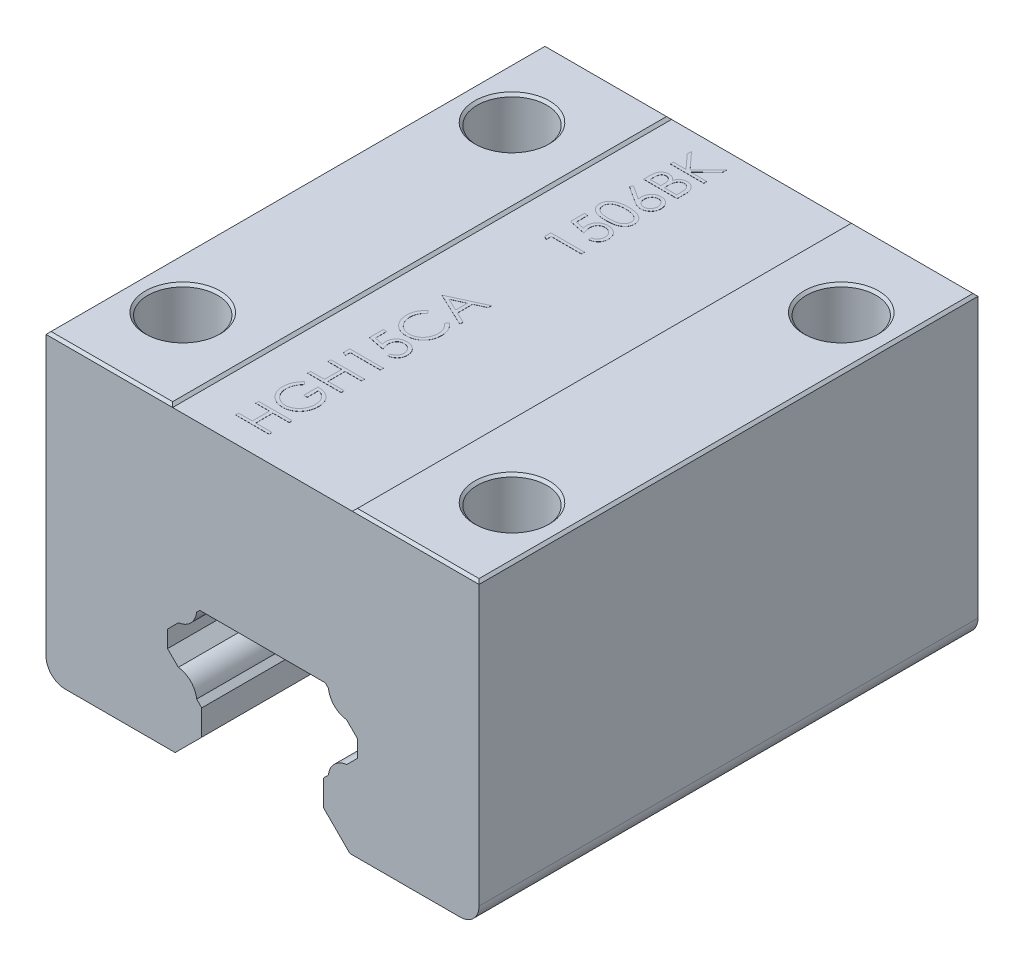
from build123d import *

# Parameters (mm, degrees)
EXTRUDE_1_DEPTH     = 39.4
SKETCH_3_R          = 2.75
CUT_EXTRUDE_2_DEPTH = 5
CHAMFER_1_SIZE      = 0.2
EXTRUDE_2_DEPTH     = 0.01


with BuildPart() as part:
    # Model → Бобышка-Вытянуть1 (new body)
    with BuildSketch(Plane.XY):
        with BuildLine():
            Line((-17.0982035, 1.500004059), (-17.0982035, 23.700000457))
            Line((-17.0982035, 23.700000457), (-7.0982035, 23.700000457))
            Line((-7.0982035, 23.700000457), (-7.0982035, 23.500000457))
            Line((-7.0982035, 23.500000457), (7.098195917, 23.500000457))
            Line((7.098195917, 23.500000457), (7.098195917, 23.700000457))
            Line((7.098195917, 23.700000457), (17.098195917, 23.700000457))
            Line((17.098195917, 23.700000457), (17.098195917, 1.499999547))
            ThreePointArc((17.098195917, 1.499999547), (16.6588565, 0.439340163), (15.598197237, 4.57e-07))
            Line((15.598197237, 4.57e-07), (6.899437737, 4.57e-07))
            Line((6.899437737, 4.57e-07), (4.799803337, 2.099634857))
            Line((4.799803337, 2.099634857), (4.799803337, 4.109149719))
            Line((4.799803337, 4.109149719), (5.200757016, 4.510103609))
            ThreePointArc((5.200757016, 4.510103609), (5.668920845, 5.489261965), (6.648079248, 5.957425695))
            Line((6.648079248, 5.957425695), (7.499998637, 6.809345503))
            Line((7.499998637, 6.809345503), (7.499998637, 8.149454901))
            Line((7.499998637, 8.149454901), (6.634489549, 9.014965643))
            ThreePointArc((6.634489549, 9.014965643), (5.66892081, 9.481617583), (5.20226883, 10.447186303))
            Line((5.20226883, 10.447186303), (4.949454863, 10.700000457))
            Line((4.949454863, 10.700000457), (-4.94945759, 10.700000457))
            Line((-4.94945759, 10.700000457), (-5.202271557, 10.447186303))
            ThreePointArc((-5.202271557, 10.447186303), (-5.668923537, 9.481617583), (-6.634492276, 9.014965643))
            Line((-6.634492276, 9.014965643), (-7.500001363, 8.149454901))
            Line((-7.500001363, 8.149454901), (-7.500001363, 6.809345503))
            Line((-7.500001363, 6.809345503), (-6.648081975, 5.957425695))
            ThreePointArc((-6.648081975, 5.957425695), (-5.668923571, 5.489261965), (-5.200759743, 4.510103609))
            Line((-5.200759743, 4.510103609), (-4.799806063, 4.109149719))
            Line((-4.799806063, 4.109149719), (-4.799806063, 2.099634857))
            Line((-4.799806063, 2.099634857), (-6.899440463, 4.57e-07))
            Line((-6.899440463, 4.57e-07), (-15.598204006, 4.516e-06))
            ThreePointArc((-15.598204006, 4.516e-06), (-16.658863823, 0.439344227), (-17.0982035, 1.500004059))
        make_face()
    extrude(amount=EXTRUDE_1_DEPTH)

    # Эскиз3 → Вырез-Вытянуть2 (cut)
    with BuildSketch(Plane.XZ.offset(-23.700000457)):
        with Locations((-13, 32.7)):
            Circle(SKETCH_3_R)
        with Locations((-13, 6.7)):
            Circle(SKETCH_3_R)
        with Locations((13, 6.7)):
            Circle(SKETCH_3_R)
        with Locations((13, 32.7)):
            Circle(SKETCH_3_R)
    extrude(amount=CUT_EXTRUDE_2_DEPTH, mode=Mode.SUBTRACT)

    # Фаска1
    chamfer_1_edges = [part.edges().sort_by_distance(p)[0] for p in [
        (-12.0982035, 23.700000457, 0),
        (-7.0982035, 23.700000457, 19.7),
        (-12.0982035, 23.700000457, 39.4),
        (-17.0982035, 23.700000457, 19.7),
        (12.098195917, 23.700000457, 0),
        (7.098195917, 23.700000457, 19.7),
        (12.098195917, 23.700000457, 39.4),
        (17.098195917, 23.700000457, 19.7),
        (-15.75, 23.700000457, 6.7),
        (10.25, 23.700000457, 6.7),
        (10.25, 23.700000457, 32.7),
        (-15.75, 23.700000457, 32.7),
    ]]
    chamfer(chamfer_1_edges, length=CHAMFER_1_SIZE - 0.0001)  # a hair under: the kernel refuses the full size

    # Эскиз4 → Бобышка-Вытянуть2 (add)
    # profile 1 of 13: a face of its own
    with BuildSketch(Plane(origin=(0, 23.500000457, 0), x_dir=(1, 0, 0), z_dir=(0, 1, 0))):
        Polygon((-4.105012861, -37.426213724), (-4.105012861, -37.188767143), (-3.019542775, -37.188767143), (-3.019542775, -35.831929536), (-4.105012861, -35.831929536), (-4.105012861, -35.594482955), (-1.459179527, -35.594482955), (-1.459179527, -35.831929536), (-2.748175254, -35.831929536), (-2.748175254, -37.188767143), (-1.459179527, -37.188767143), (-1.459179527, -37.426213724), align=None)
    # profile 2 of 13: a face of its own
    with BuildSketch(Plane(origin=(0, 23.500000457, 0), x_dir=(1, 0, 0), z_dir=(0, 1, 0))):
        with BuildLine():
            Line((-3.653440345, -32.439835519), (-3.460514998, -32.64336116))
            add(Edge.make_bspline(
                [(-3.460514998, -32.64336116), (-3.495172558, -32.680182905), (-3.563661251, -32.752948361), (-3.652381893, -32.871784031), (-3.729135952, -32.995273278), (-3.791120713, -33.123615773), (-3.839744826, -33.253446059), (-3.875090109, -33.382531696), (-3.897473979, -33.510036898), (-3.900162463, -33.59482777), (-3.90148722, -33.63660869)],
                knots=[0, 0, 0, 0, 1.089067066, 2.152164705, 3.18986567, 4.218445106, 5.218487318, 6.173592265, 7.100032889, 8, 8, 8, 8], degree=3))
            add(Edge.make_bspline(
                [(-3.90148722, -33.63660869), (-3.901174553, -33.662246588), (-3.900550032, -33.713455891), (-3.892579107, -33.789521289), (-3.881115192, -33.864788926), (-3.864528177, -33.939116715), (-3.843505853, -34.012649176), (-3.817209697, -34.085130562), (-3.786551873, -34.156696098), (-3.751126039, -34.2266716), (-3.712209855, -34.294511321), (-3.669083406, -34.358582819), (-3.623131688, -34.419298239), (-3.573194021, -34.475502699), (-3.519760054, -34.527570064), (-3.463792086, -34.576458034), (-3.404189723, -34.621255454), (-3.341198061, -34.661158884), (-3.276282576, -34.697193315), (-3.209993813, -34.728332656), (-3.142947148, -34.755403277), (-3.07463773, -34.776021092), (-3.005769801, -34.793484253), (-2.935982461, -34.805640902), (-2.865093467, -34.812517284), (-2.817621399, -34.813704501), (-2.793756517, -34.814301331)],
                knots=[0, 0, 0, 0, 1.028150113, 2.053633673, 3.06513288, 4.081487945, 5.106702018, 6.131327874, 7.172780699, 8.228344599, 9.276313556, 10.308389736, 11.324843658, 12.329040066, 13.321460474, 14.316307835, 15.308626991, 16.309440696, 17.305625405, 18.28535951, 19.246194545, 20.203493668, 21.145557131, 22.095268976, 23.042464743, 24, 24, 24, 24], degree=3))
            add(Edge.make_bspline(
                [(-2.793756517, -34.814301331), (-2.769361434, -34.813729684), (-2.720637883, -34.812587949), (-2.647917984, -34.805290592), (-2.576286519, -34.791717308), (-2.505630823, -34.773716759), (-2.435810278, -34.750832058), (-2.366897747, -34.722716289), (-2.29889993, -34.689222962), (-2.232491844, -34.65053992), (-2.167857815, -34.607821453), (-2.106465049, -34.560838118), (-2.049028, -34.509510813), (-1.994707724, -34.45478066), (-1.943847038, -34.396148996), (-1.897058989, -34.333046981), (-1.853620091, -34.266357926), (-1.814007554, -34.196052246), (-1.778623414, -34.122873047), (-1.747157493, -34.047839912), (-1.72124401, -33.970711676), (-1.700124116, -33.891894065), (-1.682812587, -33.811480933), (-1.671675532, -33.729064131), (-1.663593773, -33.645249642), (-1.663002868, -33.588750796), (-1.662705169, -33.560286574)],
                knots=[0, 0, 0, 0, 0.935915162, 1.869274651, 2.799799983, 3.730201895, 4.664668062, 5.616159355, 6.583070886, 7.570012957, 8.562524459, 9.553461134, 10.53281078, 11.515274572, 12.509912756, 13.507571325, 14.526460018, 15.561318395, 16.601025881, 17.643204557, 18.680545676, 19.719612342, 20.772381578, 21.833430283, 22.908478249, 24, 24, 24, 24], degree=3))
            add(Edge.make_bspline(
                [(-1.662705169, -33.560286574), (-1.66342195, -33.525982565), (-1.664829466, -33.458621069), (-1.675795214, -33.359603538), (-1.692899748, -33.26449519), (-1.718026888, -33.173605647), (-1.749831655, -33.086605056), (-1.789162784, -33.003814294), (-1.835606446, -32.925004751), (-1.888222163, -32.850517542), (-1.946845111, -32.782123491), (-2.0095398, -32.719876801), (-2.07711849, -32.665917961), (-2.148574019, -32.618635168), (-2.224589875, -32.579554513), (-2.304743175, -32.547467451), (-2.389083516, -32.522874463), (-2.447361034, -32.512778652), (-2.476807733, -32.5076774)],
                knots=[0, 0, 0, 0, 1.130199668, 2.219330667, 3.279027493, 4.311506524, 5.322739849, 6.327972234, 7.327472899, 8.33386792, 9.329086447, 10.29244429, 11.240784345, 12.174119183, 13.111530729, 14.052100829, 15.015757696, 16, 16, 16, 16], degree=3))
            Line((-2.476807733, -32.5076774), (-2.476807733, -33.389621844))
            Line((-2.476807733, -33.389621844), (-2.748175254, -33.389621844))
            Line((-2.748175254, -33.389621844), (-2.748175254, -32.270230818))
            add(Edge.make_bspline(
                [(-2.748175254, -32.270230818), (-2.697596378, -32.271520358), (-2.598604383, -32.274044221), (-2.454239952, -32.291747807), (-2.317887541, -32.320335289), (-2.189403552, -32.359388025), (-2.068970062, -32.409942552), (-1.956464794, -32.471456309), (-1.852614565, -32.544913805), (-1.756571569, -32.627698484), (-1.670900081, -32.720605), (-1.595602735, -32.821122945), (-1.532176353, -32.929418391), (-1.480574543, -33.0453889), (-1.440301939, -33.168654823), (-1.411748426, -33.299501396), (-1.394641251, -33.437751177), (-1.392455506, -33.532499737), (-1.391337647, -33.580957147)],
                knots=[0, 0, 0, 0, 1.140356446, 2.231883559, 3.274166699, 4.278491846, 5.25512956, 6.21435461, 7.1637429, 8.11826594, 9.068280886, 10.0076534, 10.945064095, 11.891975133, 12.864533718, 13.863980011, 14.907571808, 16, 16, 16, 16], degree=3))
            add(Edge.make_bspline(
                [(-1.391337647, -33.580957147), (-1.391767876, -33.610824928), (-1.392616425, -33.669733818), (-1.39864692, -33.756737079), (-1.407930451, -33.841341471), (-1.421949681, -33.923534668), (-1.439120878, -34.00361901), (-1.461109052, -34.08119453), (-1.486560986, -34.15655674), (-1.515510691, -34.229822122), (-1.549053551, -34.300325678), (-1.58632929, -34.368381438), (-1.6271457, -34.434365592), (-1.67220866, -34.497828675), (-1.721181115, -34.559101353), (-1.774161221, -34.61778854), (-1.830987008, -34.674218781), (-1.871338997, -34.709567465), (-1.891671515, -34.727378922)],
                knots=[0, 0, 0, 0, 1.107784379, 2.184907829, 3.233506516, 4.263428166, 5.276301166, 6.270063455, 7.25232949, 8.225834625, 9.190232166, 10.146266622, 11.1027726, 12.066435141, 13.031522626, 14.010570082, 14.99756817, 16, 16, 16, 16], degree=3))
            add(Edge.make_bspline(
                [(-1.891671515, -34.727378922), (-1.923928496, -34.753221859), (-1.987907027, -34.804478766), (-2.090414128, -34.870456896), (-2.196551249, -34.926700814), (-2.306613855, -34.972336013), (-2.420498998, -35.007970161), (-2.538061152, -35.033526078), (-2.659451706, -35.048499446), (-2.741597472, -35.050656584), (-2.783156224, -35.051747912)],
                knots=[0, 0, 0, 0, 1.023165419, 2.029347347, 3.013907458, 3.994755782, 4.975994455, 5.96558838, 6.970761222, 8, 8, 8, 8], degree=3))
            add(Edge.make_bspline(
                [(-2.783156224, -35.051747912), (-2.81427595, -35.051345566), (-2.876119891, -35.050545986), (-2.967935831, -35.040850505), (-3.058121477, -35.026939914), (-3.146603085, -35.006493613), (-3.23343984, -34.98071852), (-3.318671716, -34.948549888), (-3.402350317, -34.911097151), (-3.483894739, -34.867562067), (-3.562241353, -34.819129153), (-3.637006759, -34.76650908), (-3.706979237, -34.709295818), (-3.77232088, -34.64732277), (-3.834000134, -34.581839203), (-3.890728615, -34.511470393), (-3.94339403, -34.437282484), (-3.990984415, -34.358700372), (-4.033747019, -34.276964056), (-4.071233245, -34.192251211), (-4.102214911, -34.104592623), (-4.12850217, -34.014643695), (-4.147941609, -33.921723935), (-4.162039168, -33.826507542), (-4.171685575, -33.728498232), (-4.172461375, -33.662249567), (-4.172854741, -33.628658469)],
                knots=[0, 0, 0, 0, 1.00895651, 2.005089799, 2.991467152, 3.967318338, 4.948153826, 5.927364234, 6.919980553, 7.91976625, 8.923240147, 9.905815003, 10.88314567, 11.851989312, 12.825009789, 13.798721852, 14.781296708, 15.773896486, 16.776076962, 17.771600213, 18.775744723, 19.78957137, 20.808953803, 21.851964491, 22.910847925, 24, 24, 24, 24], degree=3))
            add(Edge.make_bspline(
                [(-4.172854741, -33.628658469), (-4.172416673, -33.601264083), (-4.171548035, -33.546944233), (-4.165527141, -33.466113471), (-4.155984088, -33.386532085), (-4.142961457, -33.308082076), (-4.125224025, -33.231030597), (-4.103998178, -33.155158147), (-4.079284717, -33.080354742), (-4.049811006, -33.006854815), (-4.016357373, -32.934164161), (-3.978700798, -32.861878603), (-3.936197372, -32.790245125), (-3.888720889, -32.719139502), (-3.837086758, -32.648113348), (-3.779818207, -32.578290077), (-3.719173624, -32.507984279), (-3.675568639, -32.462776956), (-3.653440345, -32.439835519)],
                knots=[0, 0, 0, 0, 0.985871117, 1.954866573, 2.915460327, 3.869826059, 4.81536089, 5.759505086, 6.70452669, 7.649098992, 8.607881297, 9.583363685, 10.581137262, 11.603961102, 12.659522466, 13.73993555, 14.853081303, 16, 16, 16, 16], degree=3))
        make_face()
    # profile 3 of 13: a face of its own
    with BuildSketch(Plane(origin=(0, 23.500000457, 0), x_dir=(1, 0, 0), z_dir=(0, 1, 0))):
        Polygon((-4.105012861, -31.727495776), (-4.105012861, -31.490049194), (-3.019542775, -31.490049194), (-3.019542775, -30.133211588), (-4.105012861, -30.133211588), (-4.105012861, -29.895765006), (-1.459179527, -29.895765006), (-1.459179527, -30.133211588), (-2.748175254, -30.133211588), (-2.748175254, -31.490049194), (-1.459179527, -31.490049194), (-1.459179527, -31.727495776), align=None)
    # profile 4 of 13: a face of its own
    with BuildSketch(Plane(origin=(0, 23.500000457, 0), x_dir=(1, 0, 0), z_dir=(0, 1, 0))):
        Polygon((-4.105012861, -28.892447198), (-4.105012861, -28.403243639), (-1.459179527, -28.403243639), (-1.459179527, -28.64069022), (-3.833645339, -28.64069022), (-3.833645339, -29.047741502), align=None)
    # profile 5 of 13: a face of its own
    with BuildSketch(Plane(origin=(0, 23.500000457, 0), x_dir=(1, 0, 0), z_dir=(0, 1, 0))):
        with BuildLine():
            Line((-4.105012861, -25.757410306), (-3.833645339, -25.757410306))
            Line((-3.833645339, -25.757410306), (-3.833645339, -26.657375249))
            Line((-3.833645339, -26.657375249), (-3.137736051, -26.799949201))
            add(Edge.make_bspline(
                [(-3.137736051, -26.799949201), (-3.14546965, -26.771936725), (-3.160452273, -26.717666982), (-3.177087588, -26.637566373), (-3.187115632, -26.561523457), (-3.188484896, -26.512178385), (-3.189147476, -26.488300563)],
                knots=[0, 0, 0, 0, 1.100273476, 2.13160584, 3.095893838, 4, 4, 4, 4], degree=3))
            add(Edge.make_bspline(
                [(-3.189147476, -26.488300563), (-3.188529108, -26.458749694), (-3.187313242, -26.400645301), (-3.174944981, -26.315763713), (-3.157030564, -26.234326977), (-3.129430011, -26.157537499), (-3.095724814, -26.084180392), (-3.053272383, -26.015515475), (-3.003709274, -25.950579034), (-2.947290748, -25.889819876), (-2.884553791, -25.834958145), (-2.816820061, -25.787285109), (-2.745567622, -25.745675392), (-2.669126463, -25.713223547), (-2.588938289, -25.686739676), (-2.504077457, -25.669276145), (-2.415297344, -25.657611263), (-2.354590208, -25.656310692), (-2.323633487, -25.655647485)],
                knots=[0, 0, 0, 0, 1.052805225, 2.070078116, 3.052532748, 4.020689046, 4.973125432, 5.925915817, 6.89216474, 7.881560752, 8.877013184, 9.857446635, 10.830895175, 11.812622661, 12.812548702, 13.836681939, 14.896847428, 16, 16, 16, 16], degree=3))
            add(Edge.make_bspline(
                [(-2.323633487, -25.655647485), (-2.302072181, -25.656150703), (-2.259240953, -25.657150339), (-2.195629968, -25.662222631), (-2.133374937, -25.672026118), (-2.072589991, -25.685028588), (-2.013218202, -25.702386243), (-1.95492715, -25.722689175), (-1.898355117, -25.747924376), (-1.843252248, -25.775900415), (-1.790249176, -25.806878606), (-1.740616747, -25.841712893), (-1.693222337, -25.877907725), (-1.649473488, -25.917457261), (-1.609200506, -25.959911844), (-1.57220429, -26.005035253), (-1.537820871, -26.052418211), (-1.50745609, -26.102806996), (-1.47951373, -26.15507526), (-1.456590613, -26.209978777), (-1.436096336, -26.266267509), (-1.419760565, -26.324751674), (-1.406960359, -26.385298781), (-1.398266453, -26.448008642), (-1.391934265, -26.512552362), (-1.391537876, -26.556303116), (-1.391337647, -26.578403061)],
                knots=[0, 0, 0, 0, 1.056393913, 2.098511576, 3.122979385, 4.141471433, 5.141222888, 6.151259816, 7.162667642, 8.172852865, 9.177685681, 10.166741883, 11.141342384, 12.097242845, 13.052202613, 14.005160326, 14.953864445, 15.917140761, 16.884916217, 17.854238259, 18.828761908, 19.81781811, 20.826036654, 21.857789401, 22.917898972, 24, 24, 24, 24], degree=3))
            add(Edge.make_bspline(
                [(-1.391337647, -26.578403061), (-1.391861292, -26.604765608), (-1.392891502, -26.656630807), (-1.403619979, -26.732629151), (-1.419087242, -26.805705794), (-1.44200283, -26.875547538), (-1.472009161, -26.941863104), (-1.50766122, -27.005602116), (-1.550104452, -27.065974557), (-1.598950641, -27.122567678), (-1.652622313, -27.174589301), (-1.710308845, -27.221762893), (-1.772083705, -27.26323719), (-1.837746019, -27.299162639), (-1.907179321, -27.329767847), (-1.980597548, -27.353821047), (-2.057629684, -27.373231953), (-2.110662317, -27.381444279), (-2.137598331, -27.385615434)],
                knots=[0, 0, 0, 0, 1.046872515, 2.059598001, 3.044168548, 4.012104806, 4.973680974, 5.932408326, 6.910122221, 7.900780896, 8.89867654, 9.876692837, 10.858029398, 11.85084981, 12.847361615, 13.868568023, 14.917415949, 16, 16, 16, 16], degree=3))
            Line((-2.137598331, -27.385615434), (-2.137598331, -27.148168853))
            add(Edge.make_bspline(
                [(-2.137598331, -27.148168853), (-2.112364695, -27.142330086), (-2.063864246, -27.131107653), (-1.995764203, -27.10641062), (-1.935057311, -27.076507437), (-1.8813724, -27.040120473), (-1.833726779, -26.997943323), (-1.791717741, -26.948914565), (-1.753772109, -26.894259903), (-1.722088252, -26.833494653), (-1.695398875, -26.769262844), (-1.676352459, -26.702419192), (-1.664823254, -26.633925708), (-1.663413854, -26.587810633), (-1.662705169, -26.564622679)],
                knots=[0, 0, 0, 0, 1.13623081, 2.183898708, 3.172478118, 4.09966615, 5.022692284, 5.957376522, 6.927682873, 7.937366477, 8.960015386, 9.976409503, 10.982481913, 12, 12, 12, 12], degree=3))
            add(Edge.make_bspline(
                [(-1.662705169, -26.564622679), (-1.663330829, -26.541977442), (-1.66456276, -26.497388787), (-1.673891596, -26.431735956), (-1.688636469, -26.368535878), (-1.709293191, -26.307676362), (-1.736620823, -26.249456461), (-1.770191244, -26.193958492), (-1.809166902, -26.140391837), (-1.853714657, -26.090166291), (-1.902834191, -26.044176989), (-1.955354344, -26.003539287), (-2.01138353, -25.969690239), (-2.069949444, -25.941165006), (-2.131694571, -25.919504488), (-2.19632938, -25.904052076), (-2.264013564, -25.894978336), (-2.310179054, -25.893730123), (-2.333703766, -25.893094066)],
                knots=[0, 0, 0, 0, 1.027268864, 2.022700798, 3.002744649, 3.968653148, 4.933396556, 5.915045722, 6.907600446, 7.935526002, 8.956456544, 9.95700807, 10.942805781, 11.92166854, 12.907987664, 13.905483474, 14.932689774, 16, 16, 16, 16], degree=3))
            add(Edge.make_bspline(
                [(-2.333703766, -25.893094066), (-2.354930206, -25.893576721), (-2.396302733, -25.894517464), (-2.457043999, -25.902661418), (-2.514608853, -25.916265765), (-2.569247767, -25.935635591), (-2.62078605, -25.959809752), (-2.669110124, -25.990161146), (-2.714674363, -26.025397381), (-2.756306207, -26.066534888), (-2.794790969, -26.111283979), (-2.827479252, -26.160794041), (-2.855277976, -26.213743338), (-2.878054117, -26.270229993), (-2.896197057, -26.330323585), (-2.908735891, -26.394056481), (-2.916238939, -26.461443206), (-2.917256766, -26.50753789), (-2.917779955, -26.531231753)],
                knots=[0, 0, 0, 0, 1.045723156, 2.038222538, 3.013889863, 3.95567481, 4.890389958, 5.81331128, 6.76251276, 7.723027653, 8.692928204, 9.666105983, 10.639751036, 11.635719707, 12.66315958, 13.728667616, 14.832476222, 16, 16, 16, 16], degree=3))
            add(Edge.make_bspline(
                [(-2.917779955, -26.531231753), (-2.917341056, -26.551739931), (-2.91643484, -26.594084117), (-2.909762429, -26.659037682), (-2.8989982, -26.727293925), (-2.88419193, -26.798591193), (-2.864816056, -26.873143601), (-2.841597356, -26.95079382), (-2.813837274, -27.031705117), (-2.792873041, -27.086222682), (-2.782096194, -27.114247912)],
                knots=[0, 0, 0, 0, 0.817624296, 1.688186739, 2.600797293, 3.572016777, 4.590301741, 5.671205678, 6.80286297, 8, 8, 8, 8], degree=3))
            Line((-2.782096194, -27.114247912), (-4.105012861, -26.842880391))
            Line((-4.105012861, -26.842880391), (-4.105012861, -25.757410306))
        make_face()
    # profile 6 of 13: a face of its own
    with BuildSketch(Plane(origin=(0, 23.500000457, 0), x_dir=(1, 0, 0), z_dir=(0, 1, 0))):
        with BuildLine():
            Line((-3.619519405, -22.70452569), (-3.460514998, -22.912291449))
            add(Edge.make_bspline(
                [(-3.460514998, -22.912291449), (-3.478178324, -22.927112719), (-3.513266838, -22.956555436), (-3.562542903, -23.003920576), (-3.60869249, -23.053293862), (-3.652012116, -23.104606596), (-3.690760675, -23.159046273), (-3.727955937, -23.21453859), (-3.760521669, -23.273099828), (-3.800304785, -23.353667617), (-3.840913294, -23.459474989), (-3.875840117, -23.592208769), (-3.897864168, -23.730960667), (-3.900265702, -23.825600473), (-3.90148722, -23.873738097)],
                knots=[0, 0, 0, 0, 0.75789156, 1.505565099, 2.245254514, 2.979266606, 3.711207489, 4.440978832, 5.174393176, 5.91211879, 7.394186119, 8.890401545, 10.418332761, 12, 12, 12, 12], degree=3))
            add(Edge.make_bspline(
                [(-3.90148722, -23.873738097), (-3.901181843, -23.9002594), (-3.900573925, -23.953055865), (-3.892553931, -24.031409175), (-3.881281767, -24.108299398), (-3.864556076, -24.183676519), (-3.843410108, -24.257444589), (-3.818142085, -24.330085866), (-3.786879804, -24.400548653), (-3.752326502, -24.469807632), (-3.713298739, -24.536164707), (-3.670728066, -24.598949748), (-3.625093583, -24.657937438), (-3.576214257, -24.713160987), (-3.524346964, -24.764726382), (-3.468910617, -24.811984749), (-3.41049785, -24.855567494), (-3.349060154, -24.895226231), (-3.285169725, -24.930928305), (-3.218461788, -24.960948197), (-3.150078517, -24.987167368), (-3.079535124, -25.008240778), (-3.007300477, -25.024791172), (-2.933075327, -25.036233352), (-2.857000402, -25.0441604), (-2.805437499, -25.044765532), (-2.779446121, -25.045070562)],
                knots=[0, 0, 0, 0, 1.054877232, 2.099964208, 3.13098259, 4.145888998, 5.169474743, 6.183358035, 7.203388855, 8.234598956, 9.261847606, 10.264062591, 11.251197969, 12.227332808, 13.196685059, 14.158975844, 15.123498106, 16.094582253, 17.066912473, 18.032714859, 19.002806091, 19.979168736, 20.95977404, 21.949109834, 22.966205168, 24, 24, 24, 24], degree=3))
            add(Edge.make_bspline(
                [(-2.779446121, -25.045070562), (-2.740340578, -25.04411445), (-2.663562032, -25.042237252), (-2.551086159, -25.025601512), (-2.443230761, -25.000118818), (-2.340726115, -24.962552489), (-2.242717721, -24.91530687), (-2.150394132, -24.856357365), (-2.062402781, -24.787825108), (-1.980874765, -24.709007045), (-1.906404133, -24.622519409), (-1.840824545, -24.529728439), (-1.786158012, -24.430861585), (-1.740667842, -24.327011437), (-1.705699964, -24.217378589), (-1.681083036, -24.10216026), (-1.665024959, -23.981607024), (-1.663487588, -23.899231347), (-1.662705169, -23.857307641)],
                knots=[0, 0, 0, 0, 1.029159485, 2.020618137, 2.987588728, 3.942669054, 4.889339625, 5.846988364, 6.821327795, 7.821533711, 8.827683044, 9.822769455, 10.807800696, 11.797391277, 12.803701919, 13.832062008, 14.896664671, 16, 16, 16, 16], degree=3))
            add(Edge.make_bspline(
                [(-1.662705169, -23.857307641), (-1.663981806, -23.811116918), (-1.666494533, -23.720202525), (-1.687781584, -23.586876696), (-1.722296796, -23.459244897), (-1.770600582, -23.337300263), (-1.833393985, -23.221386572), (-1.909516785, -23.11132243), (-1.999693084, -23.007014933), (-2.068547592, -22.944292595), (-2.103677391, -22.912291449)],
                knots=[0, 0, 0, 0, 1.028121516, 2.023589091, 2.998037872, 3.967518031, 4.937445131, 5.927275754, 6.942489185, 8, 8, 8, 8], degree=3))
            Line((-2.103677391, -22.912291449), (-1.946263028, -22.70452569))
            add(Edge.make_bspline(
                [(-1.946263028, -22.70452569), (-1.924690064, -22.721246514), (-1.881647469, -22.754608071), (-1.820954805, -22.808618233), (-1.763918716, -22.865556768), (-1.710824037, -22.92557003), (-1.661451002, -22.988763797), (-1.615772789, -23.055132269), (-1.574031814, -23.124618794), (-1.535690679, -23.19667145), (-1.50193261, -23.271456267), (-1.472018029, -23.348314882), (-1.44725206, -23.427718548), (-1.426302829, -23.50899886), (-1.411365085, -23.592889896), (-1.399469836, -23.678416485), (-1.392412693, -23.766379126), (-1.391699211, -23.825670959), (-1.391337647, -23.855717597)],
                knots=[0, 0, 0, 0, 0.986911346, 1.969095443, 2.935967484, 3.900112155, 4.865124501, 5.834589912, 6.812044781, 7.795288262, 8.784678562, 9.777857908, 10.776141921, 11.791195789, 12.811324908, 13.855933174, 14.913475973, 16, 16, 16, 16], degree=3))
            add(Edge.make_bspline(
                [(-1.391337647, -23.855717597), (-1.391535701, -23.884174417), (-1.391927328, -23.940444254), (-1.398271407, -24.023522477), (-1.406926863, -24.104401505), (-1.419959581, -24.182850181), (-1.435338933, -24.259296602), (-1.455954705, -24.333047759), (-1.47904842, -24.404829376), (-1.50619088, -24.474353062), (-1.536819185, -24.541677954), (-1.571435423, -24.606586907), (-1.609748499, -24.669050067), (-1.650913894, -24.729681546), (-1.696253878, -24.787585672), (-1.745138774, -24.84326423), (-1.797403818, -24.897029435), (-1.835091713, -24.930293369), (-1.854040472, -24.947017844)],
                knots=[0, 0, 0, 0, 1.114604814, 2.203992996, 3.262667896, 4.300477797, 5.318619304, 6.316056647, 7.298880507, 8.271930387, 9.238335007, 10.195173496, 11.151986948, 12.108099108, 13.064862484, 14.031167946, 15.010108607, 16, 16, 16, 16], degree=3))
            add(Edge.make_bspline(
                [(-1.854040472, -24.947017844), (-1.886956216, -24.973803756), (-1.952390317, -25.027052197), (-2.058429841, -25.095208647), (-2.169045502, -25.153355682), (-2.284878005, -25.200894517), (-2.40597238, -25.237409888), (-2.53213382, -25.263082568), (-2.663110124, -25.279649108), (-2.75218787, -25.281550602), (-2.79746662, -25.282517143)],
                knots=[0, 0, 0, 0, 0.994611881, 1.977215934, 2.950189954, 3.921972279, 4.908960509, 5.911694611, 6.938501887, 8, 8, 8, 8], degree=3))
            add(Edge.make_bspline(
                [(-2.79746662, -25.282517143), (-2.845057945, -25.281341491), (-2.938690906, -25.279028468), (-3.076103359, -25.259376885), (-3.207753523, -25.227763866), (-3.33339564, -25.182862647), (-3.453690554, -25.125935387), (-3.567719322, -25.055611697), (-3.676211188, -24.97270856), (-3.777519959, -24.877876172), (-3.870153874, -24.773881818), (-3.951650231, -24.66251581), (-4.0194724, -24.543996124), (-4.076165928, -24.419628462), (-4.119742397, -24.288481548), (-4.150247485, -24.150835191), (-4.169234828, -24.006948036), (-4.171635134, -23.908778226), (-4.172854741, -23.858897685)],
                knots=[0, 0, 0, 0, 1.032925535, 2.032216505, 3.007276963, 3.968222605, 4.92396291, 5.891752235, 6.871517503, 7.883894988, 8.900124299, 9.891468569, 10.874487609, 11.85992873, 12.854644235, 13.869047385, 14.917252991, 16, 16, 16, 16], degree=3))
            add(Edge.make_bspline(
                [(-4.172854741, -23.858897685), (-4.172489951, -23.828497559), (-4.171767885, -23.768323571), (-4.164737479, -23.679306728), (-4.15299304, -23.592647902), (-4.13709184, -23.508255953), (-4.117067487, -23.4258869), (-4.092110729, -23.345694841), (-4.062397956, -23.267876145), (-4.028467345, -23.192456095), (-3.990312568, -23.119943816), (-3.94838367, -23.050384831), (-3.902892509, -22.984056452), (-3.853373356, -22.921303427), (-3.800236968, -22.862048977), (-3.744105764, -22.805414119), (-3.683539374, -22.753047438), (-3.640898459, -22.720729213), (-3.619519405, -22.70452569)],
                knots=[0, 0, 0, 0, 1.096622143, 2.170653093, 3.219033441, 4.250379162, 5.267604342, 6.275621678, 7.278284436, 8.271072515, 9.257558938, 10.232633088, 11.19973724, 12.157384997, 13.114417402, 14.069920322, 15.032307892, 16, 16, 16, 16], degree=3))
        make_face()
    # profile 7 of 13: a face of its own
    with BuildSketch(Plane(origin=(0, 23.500000457, 0), x_dir=(1, 0, 0), z_dir=(0, 1, 0))):
        Polygon((-4.105012861, -21.076320562), (-1.459179527, -19.855166716), (-1.459179527, -20.11328387), (-2.307203032, -20.504434711), (-2.307203032, -21.703857955), (-1.459179527, -22.106139105), (-1.459179527, -22.365316288), (-4.105012861, -21.110241502), align=None)
        Polygon((-3.589308567, -21.095931105), (-2.578570553, -21.575064385), (-2.578570553, -20.629518178), align=None, mode=Mode.SUBTRACT)
    # profile 8 of 13: a face of its own
    with BuildSketch(Plane(origin=(0, 23.500000457, 0), x_dir=(1, 0, 0), z_dir=(0, 1, 0))):
        Polygon((-4.105012861, -13.017447198), (-4.105012861, -12.528243639), (-1.459179527, -12.528243639), (-1.459179527, -12.76569022), (-3.833645339, -12.76569022), (-3.833645339, -13.172741502), align=None)
    # profile 9 of 13: a face of its own
    with BuildSketch(Plane(origin=(0, 23.500000457, 0), x_dir=(1, 0, 0), z_dir=(0, 1, 0))):
        with BuildLine():
            Line((-4.105012861, -9.882410306), (-3.833645339, -9.882410306))
            Line((-3.833645339, -9.882410306), (-3.833645339, -10.782375249))
            Line((-3.833645339, -10.782375249), (-3.137736051, -10.924949201))
            add(Edge.make_bspline(
                [(-3.137736051, -10.924949201), (-3.14546965, -10.896936725), (-3.160452273, -10.842666982), (-3.177087588, -10.762566373), (-3.187115632, -10.686523457), (-3.188484896, -10.637178385), (-3.189147476, -10.613300563)],
                knots=[0, 0, 0, 0, 1.100273476, 2.13160584, 3.095893838, 4, 4, 4, 4], degree=3))
            add(Edge.make_bspline(
                [(-3.189147476, -10.613300563), (-3.188529108, -10.583749694), (-3.187313242, -10.525645301), (-3.174944981, -10.440763713), (-3.157030564, -10.359326977), (-3.129430011, -10.282537499), (-3.095724814, -10.209180392), (-3.053272383, -10.140515475), (-3.003709274, -10.075579034), (-2.947290748, -10.014819876), (-2.884553791, -9.959958145), (-2.816820061, -9.912285109), (-2.745567622, -9.870675392), (-2.669126463, -9.838223547), (-2.588938289, -9.811739676), (-2.504077457, -9.794276145), (-2.415297344, -9.782611263), (-2.354590208, -9.781310692), (-2.323633487, -9.780647485)],
                knots=[0, 0, 0, 0, 1.052805225, 2.070078116, 3.052532748, 4.020689046, 4.973125432, 5.925915817, 6.89216474, 7.881560752, 8.877013184, 9.857446635, 10.830895175, 11.812622661, 12.812548702, 13.836681939, 14.896847428, 16, 16, 16, 16], degree=3))
            add(Edge.make_bspline(
                [(-2.323633487, -9.780647485), (-2.302072181, -9.781150703), (-2.259240953, -9.782150339), (-2.195629968, -9.787222631), (-2.133374937, -9.797026118), (-2.072589991, -9.810028588), (-2.013218202, -9.827386243), (-1.95492715, -9.847689175), (-1.898355117, -9.872924376), (-1.843252248, -9.900900415), (-1.790249176, -9.931878606), (-1.740616747, -9.966712893), (-1.693222337, -10.002907725), (-1.649473488, -10.042457261), (-1.609200506, -10.084911844), (-1.57220429, -10.130035253), (-1.537820871, -10.177418211), (-1.50745609, -10.227806996), (-1.47951373, -10.28007526), (-1.456590613, -10.334978777), (-1.436096336, -10.391267509), (-1.419760565, -10.449751674), (-1.406960359, -10.510298781), (-1.398266453, -10.573008642), (-1.391934265, -10.637552362), (-1.391537876, -10.681303116), (-1.391337647, -10.703403061)],
                knots=[0, 0, 0, 0, 1.056393913, 2.098511576, 3.122979385, 4.141471433, 5.141222888, 6.151259816, 7.162667642, 8.172852865, 9.177685681, 10.166741883, 11.141342384, 12.097242845, 13.052202613, 14.005160326, 14.953864445, 15.917140761, 16.884916217, 17.854238259, 18.828761908, 19.81781811, 20.826036654, 21.857789401, 22.917898972, 24, 24, 24, 24], degree=3))
            add(Edge.make_bspline(
                [(-1.391337647, -10.703403061), (-1.391861292, -10.729765608), (-1.392891502, -10.781630807), (-1.403619979, -10.857629151), (-1.419087242, -10.930705794), (-1.44200283, -11.000547538), (-1.472009161, -11.066863104), (-1.50766122, -11.130602116), (-1.550104452, -11.190974557), (-1.598950641, -11.247567678), (-1.652622313, -11.299589301), (-1.710308845, -11.346762893), (-1.772083705, -11.38823719), (-1.837746019, -11.424162639), (-1.907179321, -11.454767847), (-1.980597548, -11.478821047), (-2.057629684, -11.498231953), (-2.110662317, -11.506444279), (-2.137598331, -11.510615434)],
                knots=[0, 0, 0, 0, 1.046872515, 2.059598001, 3.044168548, 4.012104806, 4.973680974, 5.932408326, 6.910122221, 7.900780896, 8.89867654, 9.876692837, 10.858029398, 11.85084981, 12.847361615, 13.868568023, 14.917415949, 16, 16, 16, 16], degree=3))
            Line((-2.137598331, -11.510615434), (-2.137598331, -11.273168853))
            add(Edge.make_bspline(
                [(-2.137598331, -11.273168853), (-2.112364695, -11.267330086), (-2.063864246, -11.256107653), (-1.995764203, -11.23141062), (-1.935057311, -11.201507437), (-1.8813724, -11.165120473), (-1.833726779, -11.122943323), (-1.791717741, -11.073914565), (-1.753772109, -11.019259903), (-1.722088252, -10.958494653), (-1.695398875, -10.894262844), (-1.676352459, -10.827419192), (-1.664823254, -10.758925708), (-1.663413854, -10.712810633), (-1.662705169, -10.689622679)],
                knots=[0, 0, 0, 0, 1.13623081, 2.183898708, 3.172478118, 4.09966615, 5.022692284, 5.957376522, 6.927682873, 7.937366477, 8.960015386, 9.976409503, 10.982481913, 12, 12, 12, 12], degree=3))
            add(Edge.make_bspline(
                [(-1.662705169, -10.689622679), (-1.663330829, -10.666977442), (-1.66456276, -10.622388787), (-1.673891596, -10.556735956), (-1.688636469, -10.493535878), (-1.709293191, -10.432676362), (-1.736620823, -10.374456461), (-1.770191244, -10.318958492), (-1.809166902, -10.265391837), (-1.853714657, -10.215166291), (-1.902834191, -10.169176989), (-1.955354344, -10.128539287), (-2.01138353, -10.094690239), (-2.069949444, -10.066165006), (-2.131694571, -10.044504488), (-2.19632938, -10.029052076), (-2.264013564, -10.019978336), (-2.310179054, -10.018730123), (-2.333703766, -10.018094066)],
                knots=[0, 0, 0, 0, 1.027268864, 2.022700798, 3.002744649, 3.968653148, 4.933396556, 5.915045722, 6.907600446, 7.935526002, 8.956456544, 9.95700807, 10.942805781, 11.92166854, 12.907987664, 13.905483474, 14.932689774, 16, 16, 16, 16], degree=3))
            add(Edge.make_bspline(
                [(-2.333703766, -10.018094066), (-2.354930206, -10.018576721), (-2.396302733, -10.019517464), (-2.457043999, -10.027661418), (-2.514608853, -10.041265765), (-2.569247767, -10.060635591), (-2.62078605, -10.084809752), (-2.669110124, -10.115161146), (-2.714674363, -10.150397381), (-2.756306207, -10.191534888), (-2.794790969, -10.236283979), (-2.827479252, -10.285794041), (-2.855277976, -10.338743338), (-2.878054117, -10.395229993), (-2.896197057, -10.455323585), (-2.908735891, -10.519056481), (-2.916238939, -10.586443206), (-2.917256766, -10.63253789), (-2.917779955, -10.656231753)],
                knots=[0, 0, 0, 0, 1.045723156, 2.038222538, 3.013889863, 3.95567481, 4.890389958, 5.81331128, 6.76251276, 7.723027653, 8.692928204, 9.666105983, 10.639751036, 11.635719707, 12.66315958, 13.728667616, 14.832476222, 16, 16, 16, 16], degree=3))
            add(Edge.make_bspline(
                [(-2.917779955, -10.656231753), (-2.917341056, -10.676739931), (-2.91643484, -10.719084117), (-2.909762429, -10.784037682), (-2.8989982, -10.852293925), (-2.88419193, -10.923591193), (-2.864816056, -10.998143601), (-2.841597356, -11.07579382), (-2.813837274, -11.156705117), (-2.792873041, -11.211222682), (-2.782096194, -11.239247912)],
                knots=[0, 0, 0, 0, 0.817624296, 1.688186739, 2.600797293, 3.572016777, 4.590301741, 5.671205678, 6.80286297, 8, 8, 8, 8], degree=3))
            Line((-2.782096194, -11.239247912), (-4.105012861, -10.967880391))
            Line((-4.105012861, -10.967880391), (-4.105012861, -9.882410306))
        make_face()
    # profile 10 of 13: a face of its own
    with BuildSketch(Plane(origin=(0, 23.500000457, 0), x_dir=(1, 0, 0), z_dir=(0, 1, 0))):
        with BuildLine():
            add(Edge.make_bspline(
                [(-2.781036165, -9.509279964), (-2.823443119, -9.509031998), (-2.905819238, -9.50855032), (-3.025852866, -9.503191811), (-3.138459751, -9.494290213), (-3.243645283, -9.482091127), (-3.341436618, -9.467245751), (-3.431572411, -9.447428086), (-3.514469872, -9.424891046), (-3.590399208, -9.398770978), (-3.660383782, -9.369298288), (-3.725716276, -9.337219223), (-3.786302749, -9.301265286), (-3.843092658, -9.263475171), (-3.895218661, -9.222377712), (-3.943281349, -9.178854117), (-3.986875399, -9.132033908), (-4.026030666, -9.082371199), (-4.060364121, -9.030202576), (-4.09079245, -8.976953613), (-4.115856102, -8.92167287), (-4.136358859, -8.865088086), (-4.153095733, -8.807080002), (-4.164592251, -8.747663427), (-4.171812979, -8.68670063), (-4.172504193, -8.645553298), (-4.172854741, -8.624685446)],
                knots=[0, 0, 0, 0, 1.646148282, 3.197666765, 4.66315463, 6.030252048, 7.307778049, 8.501004361, 9.610818041, 10.641065266, 11.615491391, 12.557119604, 13.464013759, 14.348536654, 15.203310953, 16.038349431, 16.863300206, 17.683791446, 18.490318933, 19.285717724, 20.06220424, 20.843281102, 21.620494212, 22.403315558, 23.190242141, 24, 24, 24, 24], degree=3))
            add(Edge.make_bspline(
                [(-4.172854741, -8.624685446), (-4.172562755, -8.603632945), (-4.171981804, -8.561745877), (-4.163804577, -8.500041152), (-4.153249994, -8.439411218), (-4.136322181, -8.380775951), (-4.116065857, -8.32302667), (-4.089337959, -8.267599485), (-4.060269295, -8.212537523), (-4.02480797, -8.160342174), (-3.98561737, -8.109453938), (-3.94112602, -8.06175153), (-3.892565223, -8.016015549), (-3.838851931, -7.973973424), (-3.780809728, -7.93382329), (-3.717952053, -7.897089284), (-3.650418207, -7.863007409), (-3.578521269, -7.830937014), (-3.500340758, -7.8028923), (-3.416364307, -7.777958307), (-3.325831469, -7.757520682), (-3.22924657, -7.740619125), (-3.126131128, -7.727500299), (-3.016694069, -7.717952639), (-2.900866926, -7.712907531), (-2.821674955, -7.711957606), (-2.781036165, -7.711470135)],
                knots=[0, 0, 0, 0, 0.810910589, 1.61342667, 2.396193133, 3.181089899, 3.963115317, 4.752255436, 5.550715454, 6.36105385, 7.181178335, 8.024612154, 8.872680183, 9.750181803, 10.651284446, 11.591556747, 12.554036451, 13.566402641, 14.62422919, 15.753422176, 16.94128843, 18.199818041, 19.531985927, 20.947085226, 22.433341622, 24, 24, 24, 24], degree=3))
            add(Edge.make_bspline(
                [(-2.781036165, -7.711470135), (-2.740574993, -7.711968331), (-2.661561578, -7.712941218), (-2.546250168, -7.717844436), (-2.437402998, -7.727733504), (-2.334904021, -7.739923025), (-2.238705712, -7.75701349), (-2.148870757, -7.777606086), (-2.065081098, -7.801068286), (-1.987937076, -7.829543411), (-1.9161649, -7.860867342), (-1.849127627, -7.894912645), (-1.786286552, -7.931439354), (-1.728091253, -7.97098733), (-1.674593558, -8.013721005), (-1.625866206, -8.059424929), (-1.581091872, -8.107543835), (-1.541469508, -8.158728741), (-1.505738198, -8.211410257), (-1.475614648, -8.266477813), (-1.44951436, -8.322522083), (-1.428174967, -8.380102615), (-1.411626018, -8.439130507), (-1.400249517, -8.499801998), (-1.392252711, -8.561754585), (-1.391643724, -8.603635857), (-1.391337647, -8.624685446)],
                knots=[0, 0, 0, 0, 1.561645053, 3.049612875, 4.452756685, 5.778837748, 7.032101753, 8.221335837, 9.334924186, 10.387562255, 11.392109817, 12.355697819, 13.287721948, 14.19548756, 15.068665045, 15.927346723, 16.771751757, 17.602390507, 18.423119567, 19.225778204, 20.022010933, 20.807278863, 21.593079439, 22.384715467, 23.188155646, 24, 24, 24, 24], degree=3))
            add(Edge.make_bspline(
                [(-1.391337647, -8.624685446), (-1.39169019, -8.645552841), (-1.392385335, -8.686699273), (-1.399577263, -8.747668666), (-1.411139935, -8.806846465), (-1.427329866, -8.864524692), (-1.44714704, -8.920999251), (-1.472965576, -8.975500644), (-1.502700346, -9.028634657), (-1.53656322, -9.080260312), (-1.575361234, -9.129404536), (-1.618267512, -9.176355264), (-1.666382315, -9.219889592), (-1.718948127, -9.260630699), (-1.77582253, -9.298820324), (-1.83704369, -9.334463571), (-1.902716144, -9.367215359), (-1.973253812, -9.397191584), (-2.049722061, -9.423768852), (-2.132830835, -9.447154253), (-2.223424273, -9.465831455), (-2.321042414, -9.48166327), (-2.425883611, -9.494349511), (-2.537985793, -9.503188115), (-2.657136088, -9.508546252), (-2.738982484, -9.50903093), (-2.781036165, -9.509279964)],
                knots=[0, 0, 0, 0, 0.810927267, 1.598990287, 2.382942141, 3.152806972, 3.926217614, 4.706701772, 5.493896336, 6.292070767, 7.104102563, 7.925577746, 8.761822141, 9.623241997, 10.509042271, 11.423174113, 12.375371989, 13.360203808, 14.400680605, 15.520553799, 16.714061498, 17.994519714, 19.364400916, 20.818312473, 22.365209998, 24, 24, 24, 24], degree=3))
        make_face()
        with BuildLine():
            add(Edge.make_bspline(
                [(-2.782096194, -9.271833382), (-2.746756545, -9.271741106), (-2.678169226, -9.271562016), (-2.578676199, -9.267018812), (-2.485723135, -9.260695136), (-2.399346314, -9.252739587), (-2.31984762, -9.240825021), (-2.246896548, -9.227307217), (-2.18062813, -9.211093437), (-2.120463257, -9.191815031), (-2.065549971, -9.169855051), (-2.014424639, -9.145920709), (-1.96648133, -9.119980578), (-1.921836361, -9.091502942), (-1.881035468, -9.059924778), (-1.843044442, -9.026710054), (-1.809184576, -8.990362464), (-1.76856819, -8.940091037), (-1.72659905, -8.873720028), (-1.690051502, -8.79009655), (-1.667083864, -8.704168534), (-1.664163041, -8.645845873), (-1.662705169, -8.616735225)],
                knots=[0, 0, 0, 0, 1.459098681, 2.831824031, 4.11146945, 5.306290378, 6.412266529, 7.42953815, 8.369053297, 9.227277979, 10.03601793, 10.809473603, 11.557037441, 12.285528272, 12.993193355, 13.685654407, 14.36688038, 15.041354379, 16.352855396, 17.594313975, 18.799247529, 20, 20, 20, 20], degree=3))
            add(Edge.make_bspline(
                [(-1.662705169, -8.616735225), (-1.66398171, -8.587456067), (-1.666530266, -8.52900161), (-1.688773056, -8.443152528), (-1.72493277, -8.36049935), (-1.766244385, -8.295270339), (-1.805838671, -8.245782975), (-1.839557685, -8.210313013), (-1.877324036, -8.177760976), (-1.918068755, -8.146886084), (-1.962573712, -8.11856887), (-2.010623946, -8.092818742), (-2.062353159, -8.069321216), (-2.098464805, -8.05593402), (-2.116927758, -8.049089492)],
                knots=[0, 0, 0, 0, 1.353621445, 2.702441307, 4.075953605, 5.516772412, 6.261413105, 7.007624062, 7.778524365, 8.566925914, 9.372323995, 10.217594641, 11.088702136, 12, 12, 12, 12], degree=3))
            add(Edge.make_bspline(
                [(-2.116927758, -8.049089492), (-2.140535954, -8.041112858), (-2.188470716, -8.02491687), (-2.262828953, -8.004043684), (-2.340845328, -7.987605198), (-2.422053601, -7.972816225), (-2.507052661, -7.96272195), (-2.59557951, -7.954597115), (-2.687700897, -7.949811417), (-2.750289968, -7.949218183), (-2.782096194, -7.948916716)],
                knots=[0, 0, 0, 0, 0.884706709, 1.796334032, 2.740027952, 3.714592787, 4.726048262, 5.777819803, 6.87074269, 8, 8, 8, 8], degree=3))
            add(Edge.make_bspline(
                [(-2.782096194, -7.948916716), (-2.813897276, -7.949332633), (-2.87610699, -7.950146255), (-2.967212995, -7.953256234), (-3.053745172, -7.96128715), (-3.136076302, -7.970206723), (-3.21375064, -7.983358192), (-3.287418424, -7.997538206), (-3.356167042, -8.016589102), (-3.421072723, -8.036939242), (-3.481398475, -8.060230183), (-3.537424078, -8.085869729), (-3.589425169, -8.113248627), (-3.637241079, -8.143000066), (-3.681149162, -8.174709637), (-3.720139095, -8.209514268), (-3.756107525, -8.245203606), (-3.79643079, -8.295961369), (-3.837869602, -8.361871868), (-3.874966747, -8.444452527), (-3.896921838, -8.52991995), (-3.899966523, -8.587817666), (-3.90148722, -8.616735225)],
                knots=[0, 0, 0, 0, 1.313483664, 2.569454835, 3.763100662, 4.901599063, 5.988328865, 7.015709358, 7.99797933, 8.932480776, 9.824041341, 10.666387587, 11.475829342, 12.24921787, 12.990555181, 13.709176526, 14.405678811, 15.080244297, 16.38186033, 17.610124501, 18.806354173, 20, 20, 20, 20], degree=3))
            add(Edge.make_bspline(
                [(-3.90148722, -8.616735225), (-3.89996274, -8.646003035), (-3.896911003, -8.704591973), (-3.875068283, -8.790972108), (-3.837978141, -8.87411065), (-3.796510627, -8.940238498), (-3.756262129, -8.990379638), (-3.722006022, -9.025960968), (-3.684922394, -9.059636335), (-3.643759551, -9.090396786), (-3.599271889, -9.118705558), (-3.55194857, -9.145648182), (-3.500727711, -9.169262459), (-3.445857484, -9.191292941), (-3.385689302, -9.210603503), (-3.319181102, -9.226632022), (-3.246055818, -9.241224094), (-3.165976261, -9.251732764), (-3.079581005, -9.260986346), (-2.98639023, -9.26694939), (-2.886555552, -9.271582829), (-2.817613373, -9.271748192), (-2.782096194, -9.271833382)],
                knots=[0, 0, 0, 0, 1.207546505, 2.417292871, 3.651582144, 4.952510111, 5.626719005, 6.30238548, 6.989136872, 7.692112372, 8.420316868, 9.164734959, 9.937886623, 10.746308695, 11.604196049, 12.543341915, 13.568754172, 14.680483261, 15.875568977, 17.154711427, 18.534182925, 20, 20, 20, 20], degree=3))
        make_face(mode=Mode.SUBTRACT)
    # profile 11 of 13: a face of its own
    with BuildSketch(Plane(origin=(0, 23.500000457, 0), x_dir=(1, 0, 0), z_dir=(0, 1, 0))):
        with BuildLine():
            Line((-4.172854741, -6.252869707), (-4.02922076, -6.070014639))
            Line((-4.02922076, -6.070014639), (-2.96018113, -6.769104015))
            add(Edge.make_bspline(
                [(-2.96018113, -6.769104015), (-2.967599941, -6.722559818), (-2.982071172, -6.631770098), (-2.984458428, -6.539872068), (-2.985621835, -6.495086421)],
                knots=[0, 0, 0, 0, 1.025318673, 2, 2, 2, 2], degree=3))
            add(Edge.make_bspline(
                [(-2.985621835, -6.495086421), (-2.98489906, -6.468195307), (-2.983476299, -6.415260951), (-2.972527198, -6.337543905), (-2.955272501, -6.262864171), (-2.930120255, -6.191531296), (-2.897990517, -6.123289181), (-2.85948309, -6.057746447), (-2.812610003, -5.996134236), (-2.760248016, -5.937662633), (-2.70225727, -5.884566085), (-2.640708568, -5.837593628), (-2.575606779, -5.797921464), (-2.506966542, -5.766314431), (-2.435325163, -5.741054814), (-2.360403236, -5.723073041), (-2.28207431, -5.712323267), (-2.228794578, -5.710871909), (-2.201730108, -5.710134664)],
                knots=[0, 0, 0, 0, 1.043709831, 2.054511743, 3.041122595, 4.01515914, 4.98481438, 5.965901842, 6.960491961, 7.985277438, 9.0096037, 10.00832444, 10.987059228, 11.962929573, 12.936966118, 13.931840027, 14.949438142, 16, 16, 16, 16], degree=3))
            add(Edge.make_bspline(
                [(-2.201730108, -5.710134664), (-2.164702399, -5.711207849), (-2.091840629, -5.713319624), (-1.985742319, -5.734450913), (-1.8847249, -5.767041768), (-1.790536343, -5.814370787), (-1.702524289, -5.872044511), (-1.62479674, -5.943240913), (-1.555476157, -6.024427623), (-1.49753364, -6.116275728), (-1.450207022, -6.215108504), (-1.416215889, -6.318940784), (-1.395288387, -6.426759929), (-1.392664792, -6.499939628), (-1.391337647, -6.536957581)],
                knots=[0, 0, 0, 0, 1.031403119, 2.029557249, 3.004870281, 3.983165322, 4.960181699, 5.929903783, 6.912123683, 7.928973898, 8.949315281, 9.960468141, 10.968302741, 12, 12, 12, 12], degree=3))
            add(Edge.make_bspline(
                [(-1.391337647, -6.536957581), (-1.392489615, -6.572561943), (-1.394771462, -6.643087949), (-1.415204442, -6.74680749), (-1.448087262, -6.84664581), (-1.494339136, -6.941321348), (-1.551774286, -7.029169496), (-1.620436647, -7.108390863), (-1.700421608, -7.176862254), (-1.789979451, -7.234357614), (-1.886081385, -7.280152655), (-1.986461121, -7.314174145), (-2.090697241, -7.334151696), (-2.161365839, -7.336936933), (-2.196959976, -7.338339793)],
                knots=[0, 0, 0, 0, 1.012172929, 2.004937354, 2.995255351, 3.995689452, 4.993936421, 5.973737378, 6.968231049, 7.979117505, 8.993136101, 9.989812463, 10.987515067, 12, 12, 12, 12], degree=3))
            add(Edge.make_bspline(
                [(-2.196959976, -7.338339793), (-2.224207965, -7.337446677), (-2.279843151, -7.335623104), (-2.364104648, -7.322890303), (-2.450321835, -7.302430607), (-2.523463398, -7.279517504), (-2.583381334, -7.255307668), (-2.63168933, -7.235159617), (-2.68140157, -7.210081656), (-2.734222712, -7.183341064), (-2.788791461, -7.152530812), (-2.846019831, -7.119030291), (-2.904997669, -7.081913293), (-2.945020959, -7.055893289), (-2.965481277, -7.042591596)],
                knots=[0, 0, 0, 0, 1.173818275, 2.396712641, 3.66331629, 4.989737886, 5.693666774, 6.447286557, 7.243889047, 8.091586357, 8.998013824, 9.943181721, 10.948533338, 12, 12, 12, 12], degree=3))
            Line((-2.965481277, -7.042591596), (-4.172854741, -6.252869707))
        make_face()
        with BuildLine():
            add(Edge.make_bspline(
                [(-2.714254314, -6.544907802), (-2.713671828, -6.565065153), (-2.712534065, -6.604438315), (-2.705783168, -6.662171216), (-2.693495768, -6.716988917), (-2.676458217, -6.768907331), (-2.65545291, -6.81824674), (-2.628501257, -6.864029374), (-2.597108732, -6.907197335), (-2.561332128, -6.947060913), (-2.522187969, -6.983212429), (-2.480254316, -7.014342849), (-2.436549878, -7.041196235), (-2.390707366, -7.063029477), (-2.342744858, -7.080030913), (-2.2928828, -7.092328934), (-2.240786868, -7.099173139), (-2.205459321, -7.100311778), (-2.187419712, -7.100893211)],
                knots=[0, 0, 0, 0, 1.129656352, 2.206547016, 3.251334079, 4.271920891, 5.265058649, 6.249872215, 7.241923875, 8.251504132, 9.246416584, 10.222533834, 11.173322129, 12.116503788, 13.062124155, 14.020151864, 14.989013135, 16, 16, 16, 16], degree=3))
            add(Edge.make_bspline(
                [(-2.187419712, -7.100893211), (-2.169544577, -7.100402944), (-2.13431943, -7.099436813), (-2.082612513, -7.091211176), (-2.032967482, -7.078063353), (-1.985570915, -7.059070437), (-1.939512921, -7.03599026), (-1.896231261, -7.006365077), (-1.854323952, -6.972363973), (-1.815738145, -6.932664579), (-1.779916654, -6.889733819), (-1.748476608, -6.84396354), (-1.721890788, -6.796042891), (-1.699861499, -6.746109886), (-1.683644801, -6.69354729), (-1.671230036, -6.639208588), (-1.664442715, -6.58235498), (-1.663291952, -6.543864076), (-1.662705169, -6.524237229)],
                knots=[0, 0, 0, 0, 0.989367052, 1.949669134, 2.891858276, 3.827522767, 4.772653562, 5.738670152, 6.725809442, 7.756636004, 8.798867547, 9.819240912, 10.826537776, 11.829883227, 12.835515726, 13.868058748, 14.912904531, 16, 16, 16, 16], degree=3))
            add(Edge.make_bspline(
                [(-1.662705169, -6.524237229), (-1.663291998, -6.504610413), (-1.66444285, -6.466119573), (-1.671229522, -6.409265507), (-1.683646685, -6.354928495), (-1.699854671, -6.30235976), (-1.721916273, -6.252449524), (-1.748310234, -6.204570763), (-1.780109428, -6.159233371), (-1.81567664, -6.116274672), (-1.854544439, -6.076740263), (-1.895853656, -6.04193949), (-1.93985924, -6.013239861), (-1.985389816, -5.989244572), (-2.032995792, -5.970461955), (-2.082604786, -5.957249403), (-2.134321446, -5.949041265), (-2.169545255, -5.948072732), (-2.187419712, -5.947581246)],
                knots=[0, 0, 0, 0, 1.087281468, 2.132306021, 3.165025708, 4.170830268, 5.174347389, 6.181816599, 7.194310624, 8.23672049, 9.267723423, 10.261267456, 11.222032883, 12.171822355, 13.107646935, 14.049997283, 15.01046367, 16, 16, 16, 16], degree=3))
            add(Edge.make_bspline(
                [(-2.187419712, -5.947581246), (-2.205482855, -5.947997241), (-2.240934929, -5.948813704), (-2.292859496, -5.95804838), (-2.3429982, -5.970856006), (-2.391035888, -5.990195568), (-2.436783138, -6.015320778), (-2.480470487, -6.045924443), (-2.522435035, -6.081327097), (-2.561408728, -6.122224363), (-2.597069946, -6.166734586), (-2.628458083, -6.214098257), (-2.655251125, -6.263451729), (-2.676392957, -6.315490217), (-2.693425057, -6.369513547), (-2.705739359, -6.425894759), (-2.712516467, -6.484673952), (-2.713667653, -6.524574117), (-2.714254314, -6.544907802)],
                knots=[0, 0, 0, 0, 0.978259475, 1.920005202, 2.851759169, 3.7803069, 4.719124913, 5.675758531, 6.668034766, 7.691045932, 8.733780038, 9.756656648, 10.768121246, 11.773215211, 12.79725739, 13.836288844, 14.897342417, 16, 16, 16, 16], degree=3))
        make_face(mode=Mode.SUBTRACT)
    # profile 12 of 13: a face of its own
    with BuildSketch(Plane(origin=(0, 23.500000457, 0), x_dir=(1, 0, 0), z_dir=(0, 1, 0))):
        with BuildLine():
            Line((-4.105012861, -5.201320562), (-4.105012861, -4.685086254))
            add(Edge.make_bspline(
                [(-4.105012861, -4.685086254), (-4.104882093, -4.659815517), (-4.104628634, -4.610834541), (-4.100606413, -4.539614546), (-4.095259251, -4.472883885), (-4.086289674, -4.41076048), (-4.076989406, -4.352840104), (-4.063338839, -4.299710769), (-4.04826129, -4.250927451), (-4.025062436, -4.192348672), (-3.989034322, -4.12588302), (-3.935601205, -4.05444488), (-3.871539214, -3.992346491), (-3.798535521, -3.939544453), (-3.718223186, -3.897169694), (-3.632330155, -3.866901259), (-3.542301475, -3.847455664), (-3.480578491, -3.845480946), (-3.449384689, -3.844482955)],
                knots=[0, 0, 0, 0, 1.00128172, 1.940733171, 2.826250472, 3.653024905, 4.427672124, 5.149348099, 5.824709082, 6.450061444, 7.643590664, 8.808605388, 9.972104426, 11.165284501, 12.367876273, 13.557044126, 14.765369432, 16, 16, 16, 16], degree=3))
            add(Edge.make_bspline(
                [(-3.449384689, -3.844482955), (-3.420166482, -3.845314208), (-3.362749951, -3.8469477), (-3.278916464, -3.862377421), (-3.199195719, -3.886866595), (-3.123655944, -3.92071162), (-3.05370332, -3.964319042), (-2.98955454, -4.016566863), (-2.933634075, -4.079342202), (-2.902383145, -4.126398808), (-2.886509088, -4.150301431)],
                knots=[0, 0, 0, 0, 1.044641374, 2.052818814, 3.038628718, 4.023282556, 5.005660861, 5.98021751, 6.974042014, 8, 8, 8, 8], degree=3))
            add(Edge.make_bspline(
                [(-2.886509088, -4.150301431), (-2.874965739, -4.120247344), (-2.852880453, -4.062746429), (-2.813894979, -3.983571135), (-2.771338606, -3.915605356), (-2.725582906, -3.857521416), (-2.675535737, -3.808107018), (-2.62079049, -3.765311292), (-2.561391982, -3.728313553), (-2.497558522, -3.696828733), (-2.429831256, -3.672097014), (-2.359037404, -3.653919543), (-2.285448355, -3.643167174), (-2.235509353, -3.641700386), (-2.210210343, -3.640957314)],
                knots=[0, 0, 0, 0, 1.272586185, 2.434772614, 3.483318042, 4.437947805, 5.351807173, 6.25737843, 7.180033415, 8.1141739, 9.066731021, 10.025721652, 10.999834114, 12, 12, 12, 12], degree=3))
            add(Edge.make_bspline(
                [(-2.210210343, -3.640957314), (-2.18438171, -3.641695602), (-2.13356315, -3.643148203), (-2.058910472, -3.653869892), (-1.987561989, -3.672011161), (-1.919089086, -3.697042546), (-1.853635325, -3.729487389), (-1.791437824, -3.769542362), (-1.732367181, -3.816645176), (-1.676319146, -3.86987897), (-1.625033431, -3.929203868), (-1.580945012, -3.994583724), (-1.543035255, -4.064227448), (-1.512170483, -4.13902537), (-1.488358331, -4.218786544), (-1.471767811, -4.303466589), (-1.460570387, -4.392926049), (-1.459651014, -4.454317203), (-1.459179527, -4.48580073)],
                knots=[0, 0, 0, 0, 0.978680899, 1.925582087, 2.851223405, 3.764209995, 4.683484765, 5.614004905, 6.562443559, 7.542772147, 8.539900013, 9.527881485, 10.525548727, 11.540192123, 12.58875426, 13.674701727, 14.807505862, 16, 16, 16, 16], degree=3))
            Line((-1.459179527, -4.48580073), (-1.459179527, -5.201320562))
            Line((-1.459179527, -5.201320562), (-4.105012861, -5.201320562))
        make_face()
        with BuildLine():
            Line((-3.833645339, -4.963873981), (-2.985621835, -4.963873981))
            Line((-2.985621835, -4.963873981), (-2.985621835, -4.804339559))
            add(Edge.make_bspline(
                [(-2.985621835, -4.804339559), (-2.985924158, -4.781019339), (-2.986508307, -4.735959921), (-2.988181621, -4.67070619), (-2.992867045, -4.610135489), (-2.99755113, -4.554352385), (-3.005167017, -4.503444679), (-3.014232562, -4.457525295), (-3.023820005, -4.415873113), (-3.040126477, -4.367841367), (-3.064217924, -4.31335002), (-3.101642181, -4.255297993), (-3.146181773, -4.203882787), (-3.198055013, -4.160986192), (-3.254554092, -4.125568648), (-3.315183002, -4.100757545), (-3.378721664, -4.084216721), (-3.422425264, -4.082699741), (-3.444614557, -4.081929536)],
                knots=[0, 0, 0, 0, 1.156917035, 2.235399477, 3.236897345, 4.169954739, 5.01148057, 5.788325709, 6.491867502, 7.129259015, 8.302032419, 9.437271567, 10.542795419, 11.662606952, 12.764338259, 13.836858145, 14.901724648, 16, 16, 16, 16], degree=3))
            add(Edge.make_bspline(
                [(-3.444614557, -4.081929536), (-3.45930144, -4.082320599), (-3.488111365, -4.083087711), (-3.530246029, -4.089598595), (-3.569837159, -4.100147956), (-3.607264729, -4.114434634), (-3.641598575, -4.133952357), (-3.674479257, -4.156575962), (-3.703937383, -4.184508014), (-3.731391181, -4.216073714), (-3.755962239, -4.252190503), (-3.776315552, -4.293636521), (-3.794762417, -4.339340323), (-3.808418082, -4.39054188), (-3.820426099, -4.446180276), (-3.827970816, -4.507008878), (-3.832825913, -4.572642226), (-3.833366105, -4.618117893), (-3.833645339, -4.641625049)],
                knots=[0, 0, 0, 0, 0.911708768, 1.788416306, 2.640049961, 3.452993646, 4.268229297, 5.087074648, 5.92553149, 6.781184137, 7.681934069, 8.628939405, 9.643570426, 10.73771997, 11.914765019, 13.176320755, 14.540391495, 16, 16, 16, 16], degree=3))
            Line((-3.833645339, -4.641625049), (-3.833645339, -4.963873981))
        make_face(mode=Mode.SUBTRACT)
        with BuildLine():
            Line((-2.714254314, -4.963873981), (-1.730547049, -4.963873981))
            Line((-1.730547049, -4.963873981), (-1.730547049, -4.625724608))
            add(Edge.make_bspline(
                [(-1.730547049, -4.625724608), (-1.730865989, -4.601522357), (-1.731480703, -4.554875707), (-1.732922337, -4.487472921), (-1.738375819, -4.42516398), (-1.743406631, -4.367752323), (-1.752009103, -4.315390319), (-1.760127601, -4.267675197), (-1.77217893, -4.225390234), (-1.788742065, -4.175907045), (-1.815257587, -4.120596277), (-1.853996514, -4.060151563), (-1.901806331, -4.007444709), (-1.956180944, -3.962200795), (-2.015139617, -3.924863553), (-2.077911578, -3.89807055), (-2.143276032, -3.881420422), (-2.187853991, -3.879411428), (-2.210210343, -3.878403895)],
                knots=[0, 0, 0, 0, 1.160376723, 2.23647316, 3.230273494, 4.158083346, 4.997711197, 5.773399541, 6.476071462, 7.102777513, 8.27340052, 9.405620712, 10.53304798, 11.669441455, 12.787990954, 13.865552736, 14.929550474, 16, 16, 16, 16], degree=3))
            add(Edge.make_bspline(
                [(-2.210210343, -3.878403895), (-2.224190729, -3.878611978), (-2.251925996, -3.879024786), (-2.292679398, -3.885278737), (-2.33217589, -3.894326221), (-2.370580059, -3.906242018), (-2.407246189, -3.92289966), (-2.442314896, -3.943320533), (-2.476492628, -3.96669585), (-2.520260175, -4.002759543), (-2.570061571, -4.055980354), (-2.618217933, -4.131613066), (-2.657681604, -4.217135312), (-2.674365156, -4.279308721), (-2.682983447, -4.311425897)],
                knots=[0, 0, 0, 0, 0.723302347, 1.434937762, 2.129609326, 2.821140842, 3.513216847, 4.209993937, 4.920569932, 5.655069131, 7.14393391, 8.6716197, 10.280644748, 12, 12, 12, 12], degree=3))
            add(Edge.make_bspline(
                [(-2.682983447, -4.311425897), (-2.685595326, -4.324299083), (-2.691258418, -4.352210804), (-2.697236266, -4.397724868), (-2.702561995, -4.449685912), (-2.706501382, -4.50821392), (-2.710573353, -4.573382943), (-2.712156938, -4.645332161), (-2.714046259, -4.72376775), (-2.714183188, -4.778190556), (-2.714254314, -4.806459618)],
                knots=[0, 0, 0, 0, 0.634451884, 1.375622551, 2.216452059, 3.157844607, 4.20941857, 5.370758133, 6.634282058, 8, 8, 8, 8], degree=3))
            Line((-2.714254314, -4.806459618), (-2.714254314, -4.963873981))
        make_face(mode=Mode.SUBTRACT)
    # profile 13 of 13: a face of its own
    with BuildSketch(Plane(origin=(0, 23.500000457, 0), x_dir=(1, 0, 0), z_dir=(0, 1, 0))):
        Polygon((-4.105012861, -3.098222271), (-4.105012861, -2.86077569), (-3.097454935, -2.86077569), (-4.105012861, -1.75781512), (-4.105012861, -1.419135733), (-2.917779955, -2.719261768), (-1.459179527, -1.317372912), (-1.459179527, -1.633791682), (-2.735984916, -2.86077569), (-1.459179527, -2.86077569), (-1.459179527, -3.098222271), align=None)
    extrude(amount=EXTRUDE_2_DEPTH)


solid = part.part
